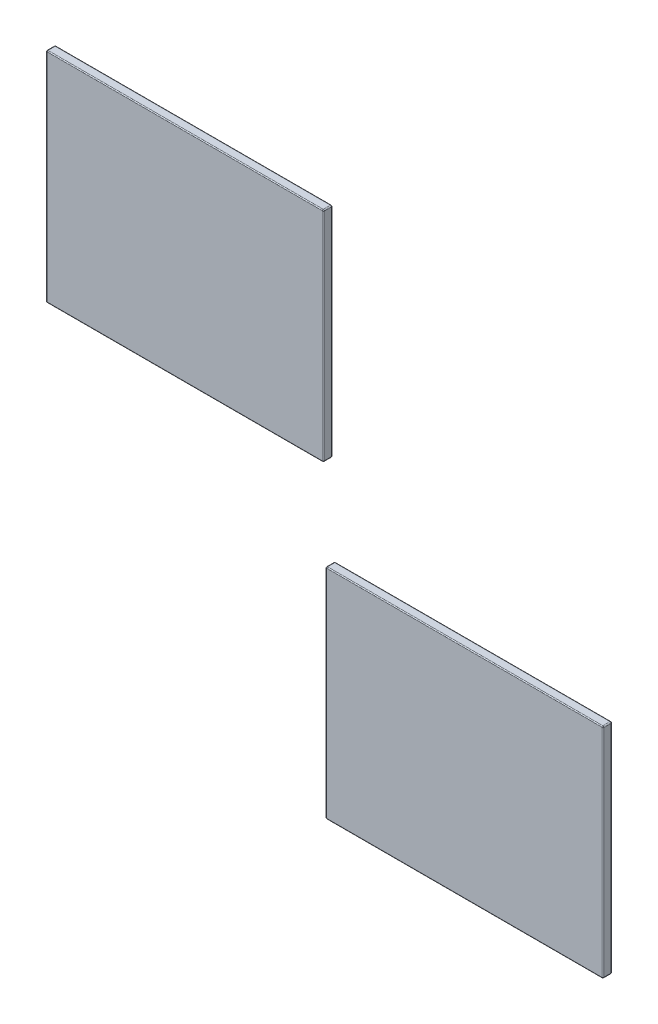
from build123d import *

# Parameters (mm, degrees)
ESQUISSE1_W          = 622.5
ESQUISSE1_H          = 490
BOSS_EXTRU_1_DEPTH   = 20
BOSS_EXTRU_1_2_DEPTH = 20
CONG_1_R             = 2.5
CONG_2_R             = 2.5
CONG_3_R             = 2
CONG_4_R             = 2


with BuildPart() as part:
    # Esquisse1 → Boss.-Extru.1 (new body)
    with BuildSketch(Plane.XY):
        with Locations((311.25, 245)):
            Rectangle(ESQUISSE1_W, ESQUISSE1_H)
    extrude(amount=-BOSS_EXTRU_1_DEPTH)

    # Congé2
    cong_2_edges = [part.edges().sort_by_distance(p)[0] for p in [
        (622.5, 0, -10),
        (0, 0, -10),
        (0, 490, -10),
        (622.5, 490, -10),
    ]]
    fillet(cong_2_edges, radius=CONG_2_R)

    # Congé4
    cong_4_edges = [part.edges().sort_by_distance(p)[0] for p in [
        (621.767766953, 489.267766953, -20),
        (311.25, 490, -20),
        (0.732233047, 489.267766953, -20),
        (0, 245, -20),
        (0.732233047, 0.732233047, -20),
        (311.25, 0, -20),
        (621.767766953, 0.732233047, -20),
        (622.5, 245, -20),
        (0.732233047, 0.732233047, 0),
        (0, 245, 0),
        (0.732233047, 489.267766953, 0),
        (311.25, 490, 0),
        (621.767766953, 489.267766953, 0),
        (622.5, 245, 0),
        (621.767766953, 0.732233047, 0),
        (311.25, 0, 0),
    ]]
    fillet(cong_4_edges, radius=CONG_4_R)


with BuildPart() as body_2:
    # Esquisse1 → Boss.-Extru.1 2 (new body)
    with BuildSketch(Plane.XY):
        with Locations((-316.25, 935)):
            Rectangle(ESQUISSE1_W, ESQUISSE1_H)
    extrude(amount=-BOSS_EXTRU_1_2_DEPTH)

    # Congé1
    cong_1_edges = [body_2.edges().sort_by_distance(p)[0] for p in [
        (-627.5, 690, -10),
        (-627.5, 1180, -10),
        (-5, 690, -10),
        (-5, 1180, -10),
    ]]
    fillet(cong_1_edges, radius=CONG_1_R)

    # Congé3
    cong_3_edges = [body_2.edges().sort_by_distance(p)[0] for p in [
        (-5.732233047, 690.732233047, -20),
        (-5, 935, -20),
        (-5.732233047, 1179.267766953, -20),
        (-316.25, 1180, -20),
        (-626.767766953, 1179.267766953, -20),
        (-627.5, 935, -20),
        (-626.767766953, 690.732233047, -20),
        (-316.25, 690, -20),
        (-626.767766953, 1179.267766953, 0),
        (-316.25, 1180, 0),
        (-5.732233047, 1179.267766953, 0),
        (-5, 935, 0),
        (-5.732233047, 690.732233047, 0),
        (-316.25, 690, 0),
        (-626.767766953, 690.732233047, 0),
        (-627.5, 935, 0),
    ]]
    fillet(cong_3_edges, radius=CONG_3_R)


solid = Compound([part.part, body_2.part])
